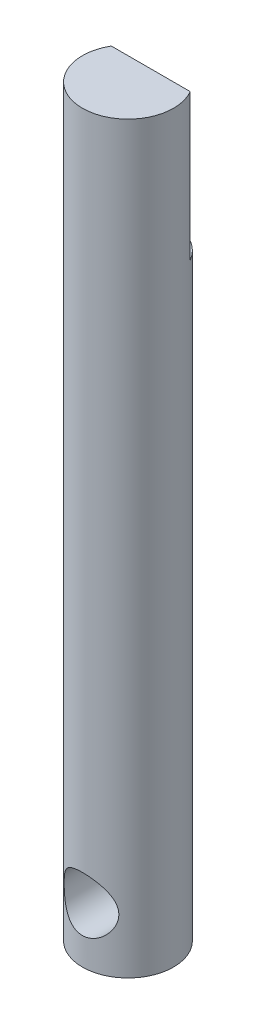
from build123d import *

# Parameters (mm, degrees)
SKETCH1_R               = 3.96875
BOSS_EXTRUDE1_DEPTH     = 64.77
CUT_EXTRUDE1_DEPTH      = 12.7
CUT_EXTRUDE2_DEPTH      = 12.7
CUT_EXTRUDE2_DEPTH_BACK = 12.7
SKETCH3_R               = 2.38125


with BuildPart() as part:
    # Sketch1 → Boss-Extrude1 (new body)
    with BuildSketch(Plane(origin=(0, 0, 0), x_dir=(1, 0, 0), z_dir=(0, 1, 0))):
        Circle(SKETCH1_R)
    extrude(amount=BOSS_EXTRUDE1_DEPTH)

    # Sketch2 → Cut-Extrude1 (cut)
    with BuildSketch(Plane(origin=(0, 64.77, 0), x_dir=(1, 0, 0), z_dir=(0, 1, 0))):
        Polygon((3.437038321, 1.984375), (-3.437038321, 1.984375), (-4.719395918, 2.522465653), (-2.590204502, 6.353236507), (2.456720437, 4.728926773), align=None)
    extrude(amount=-CUT_EXTRUDE1_DEPTH, mode=Mode.SUBTRACT)

    # Sketch3 → Cut-Extrude2 (cut, two sides: drawn at the far end of the back side and taken through both)
    with BuildSketch(Plane(origin=(0, 0, -1.984375), x_dir=(-1, 0, 0), z_dir=(0, 0, -1)).offset(-CUT_EXTRUDE2_DEPTH_BACK)):
        with Locations((0, 4.7625)):
            Circle(SKETCH3_R)
    extrude(amount=CUT_EXTRUDE2_DEPTH + CUT_EXTRUDE2_DEPTH_BACK, mode=Mode.SUBTRACT)


solid = part.part
